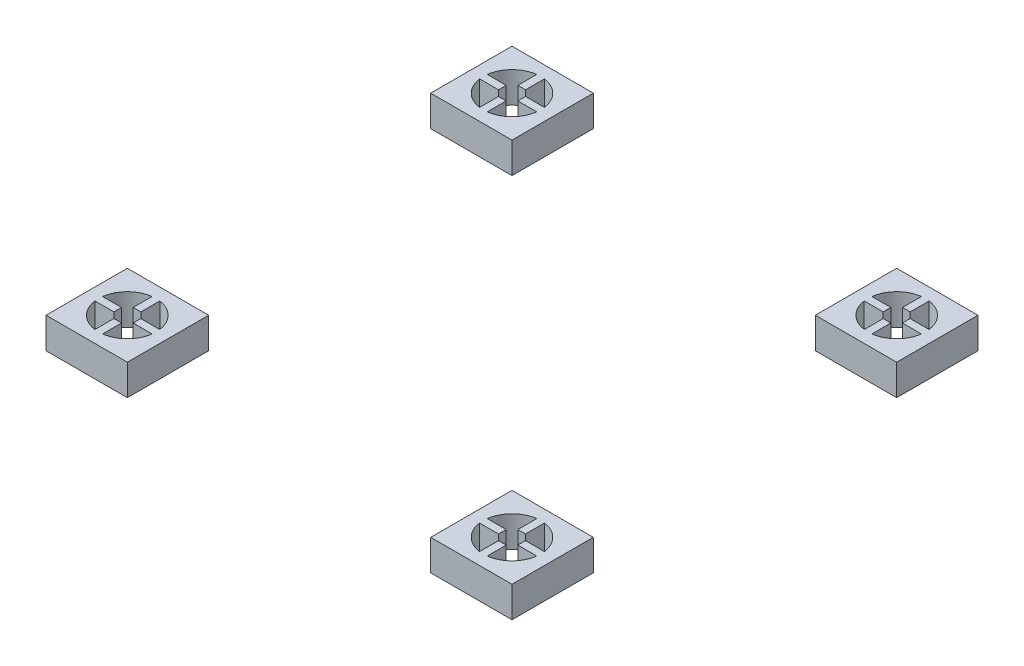
from build123d import *

# Parameters (mm, degrees)
SKETCH2_W             = 211.424938922
SKETCH2_H             = 211.424938922
BOSS_EXTRUDE1_DEPTH   = 80
BOSS_EXTRUDE1_2_DEPTH = 80
BOSS_EXTRUDE1_3_DEPTH = 80
BOSS_EXTRUDE1_4_DEPTH = 80


with BuildPart() as part:
    # Sketch2 → Boss-Extrude1 (new body)
    with BuildSketch(Plane(origin=(0, 0, 0), x_dir=(1, 0, 0), z_dir=(0, 1, 0))):
        with Locations((500, -500)):
            Rectangle(SKETCH2_W, SKETCH2_H)
        with BuildLine():
            Line((510, -475), (510, -425.669656263))
            ThreePointArc((510, -425.669656263), (553.033008589, -446.966991411), (574.330343737, -490))
            Line((574.330343737, -490), (525, -490))
            Line((525, -490), (525, -510))
            Line((525, -510), (574.330343737, -510))
            ThreePointArc((574.330343737, -510), (553.033008589, -553.033008589), (510, -574.330343737))
            Line((510, -574.330343737), (510, -525))
            Line((510, -525), (490, -525))
            Line((490, -525), (490, -574.330343737))
            ThreePointArc((490, -574.330343737), (446.966991411, -553.033008589), (425.669656263, -510))
            Line((425.669656263, -510), (475, -510))
            Line((475, -510), (475, -490))
            Line((475, -490), (425.669656263, -490))
            ThreePointArc((425.669656263, -490), (446.966991411, -446.966991411), (490, -425.669656263))
            Line((490, -425.669656263), (490, -475))
            Line((490, -475), (510, -475))
        make_face(mode=Mode.SUBTRACT)
    extrude(amount=BOSS_EXTRUDE1_DEPTH)


with BuildPart() as body_2:
    # Sketch2 → Boss-Extrude1 2 (new body)
    with BuildSketch(Plane(origin=(0, 0, 0), x_dir=(1, 0, 0), z_dir=(0, 1, 0))):
        with Locations((-500, -500)):
            Rectangle(SKETCH2_W, SKETCH2_H)
        with BuildLine():
            Line((-490, -475), (-490, -425.669656263))
            ThreePointArc((-490, -425.669656263), (-446.966991411, -446.966991411), (-425.669656263, -490))
            Line((-425.669656263, -490), (-475, -490))
            Line((-475, -490), (-475, -510))
            Line((-475, -510), (-425.669656263, -510))
            ThreePointArc((-425.669656263, -510), (-446.966991411, -553.033008589), (-490, -574.330343737))
            Line((-490, -574.330343737), (-490, -525))
            Line((-490, -525), (-510, -525))
            Line((-510, -525), (-510, -574.330343737))
            ThreePointArc((-510, -574.330343737), (-553.033008589, -553.033008589), (-574.330343737, -510))
            Line((-574.330343737, -510), (-525, -510))
            Line((-525, -510), (-525, -490))
            Line((-525, -490), (-574.330343737, -490))
            ThreePointArc((-574.330343737, -490), (-553.033008589, -446.966991411), (-510, -425.669656263))
            Line((-510, -425.669656263), (-510, -475))
            Line((-510, -475), (-490, -475))
        make_face(mode=Mode.SUBTRACT)
    extrude(amount=BOSS_EXTRUDE1_2_DEPTH)


with BuildPart() as body_3:
    # Sketch2 → Boss-Extrude1 3 (new body)
    with BuildSketch(Plane(origin=(0, 0, 0), x_dir=(1, 0, 0), z_dir=(0, 1, 0))):
        with Locations((500, 500)):
            Rectangle(SKETCH2_W, SKETCH2_H)
        with BuildLine():
            Line((510, 525), (510, 574.330343737))
            ThreePointArc((510, 574.330343737), (553.033008589, 553.033008589), (574.330343737, 510))
            Line((574.330343737, 510), (525, 510))
            Line((525, 510), (525, 490))
            Line((525, 490), (574.330343737, 490))
            ThreePointArc((574.330343737, 490), (553.033008589, 446.966991411), (510, 425.669656263))
            Line((510, 425.669656263), (510, 475))
            Line((510, 475), (490, 475))
            Line((490, 475), (490, 425.669656263))
            ThreePointArc((490, 425.669656263), (446.966991411, 446.966991411), (425.669656263, 490))
            Line((425.669656263, 490), (475, 490))
            Line((475, 490), (475, 510))
            Line((475, 510), (425.669656263, 510))
            ThreePointArc((425.669656263, 510), (446.966991411, 553.033008589), (490, 574.330343737))
            Line((490, 574.330343737), (490, 525))
            Line((490, 525), (510, 525))
        make_face(mode=Mode.SUBTRACT)
    extrude(amount=BOSS_EXTRUDE1_3_DEPTH)


with BuildPart() as body_4:
    # Sketch2 → Boss-Extrude1 4 (new body)
    with BuildSketch(Plane(origin=(0, 0, 0), x_dir=(1, 0, 0), z_dir=(0, 1, 0))):
        with Locations((-500, 500)):
            Rectangle(SKETCH2_W, SKETCH2_H)
        with BuildLine():
            Line((-490, 525), (-490, 574.330343737))
            ThreePointArc((-490, 574.330343737), (-446.966991411, 553.033008589), (-425.669656263, 510))
            Line((-425.669656263, 510), (-475, 510))
            Line((-475, 510), (-475, 490))
            Line((-475, 490), (-425.669656263, 490))
            ThreePointArc((-425.669656263, 490), (-446.966991411, 446.966991411), (-490, 425.669656263))
            Line((-490, 425.669656263), (-490, 475))
            Line((-490, 475), (-510, 475))
            Line((-510, 475), (-510, 425.669656263))
            ThreePointArc((-510, 425.669656263), (-553.033008589, 446.966991411), (-574.330343737, 490))
            Line((-574.330343737, 490), (-525, 490))
            Line((-525, 490), (-525, 510))
            Line((-525, 510), (-574.330343737, 510))
            ThreePointArc((-574.330343737, 510), (-553.033008589, 553.033008589), (-510, 574.330343737))
            Line((-510, 574.330343737), (-510, 525))
            Line((-510, 525), (-490, 525))
        make_face(mode=Mode.SUBTRACT)
    extrude(amount=BOSS_EXTRUDE1_4_DEPTH)


solid = Compound([part.part, body_2.part, body_3.part, body_4.part])
